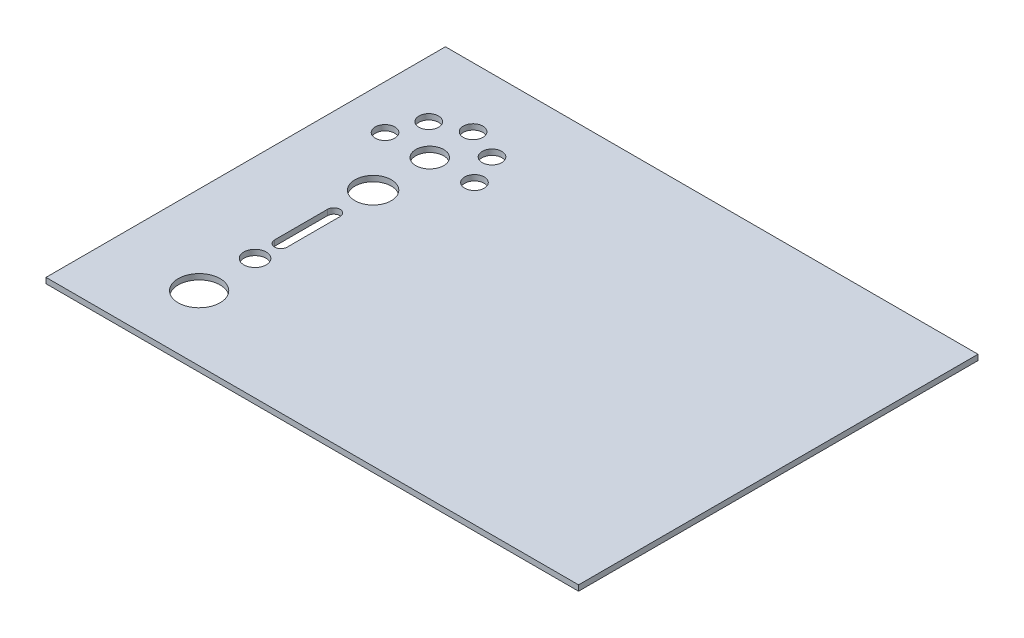
from build123d import *

# Parameters (mm, degrees)
SKETCH1_W           = 609.6
SKETCH1_H           = 457.2
BOSS_EXTRUDE1_DEPTH = 6.35
SKETCH2_R           = 23.995498827
SKETCH2_R_2         = 12.797599375
SKETCH2_R_3         = 20.796098984
SKETCH2_R_4         = 15.996999218
SKETCH2_R_5         = 11.197899453
CUT_EXTRUDE1_DEPTH  = 382.052912992


with BuildPart() as part:
    # Sketch1 → Boss-Extrude1 (new body)
    with BuildSketch(Plane(origin=(0, 0, 0), x_dir=(1, 0, 0), z_dir=(0, 1, 0))):
        Rectangle(SKETCH1_W, SKETCH1_H)
    extrude(amount=BOSS_EXTRUDE1_DEPTH)

    # Sketch2 → Cut-Extrude1 (cut, through all)
    with BuildSketch(Plane(origin=(0, 6.35, 0), x_dir=(1, 0, 0), z_dir=(0, 1, 0))):
        with BuildLine():
            Line((-196.763090385, -60.558852712), (-196.763090385, 0))
            ThreePointArc((-196.763090385, 0), (-203.961740033, 7.198649648), (-211.160389681, 0))
            Line((-211.160389681, 0), (-211.160389681, -60.558852712))
            ThreePointArc((-211.160389681, -60.558852712), (-203.961740033, -67.75750236), (-196.763090385, -60.558852712))
        make_face()
        with Locations((-203.961740033, -154.141298139)):
            Circle(SKETCH2_R)
        with Locations((-203.961740033, -90.153301266)):
            Circle(SKETCH2_R_2)
        with Locations((-203.961740033, 45.021342129)):
            Circle(SKETCH2_R_3)
        with Locations((-203.961740033, 109.809188963)):
            Circle(SKETCH2_R_4)
        with Locations((-254.35228757, 109.009339002)):
            Circle(SKETCH2_R_5)
        with Locations((-240.158817236, 144.875107503)):
            Circle(SKETCH2_R_5)
        with Locations((-204.761589994, 160.1997365)):
            Circle(SKETCH2_R_5)
        with Locations((-168.895821493, 146.006266165)):
            Circle(SKETCH2_R_5)
        with Locations((-153.571192495, 110.609038924)):
            Circle(SKETCH2_R_5)
    extrude(amount=-CUT_EXTRUDE1_DEPTH, mode=Mode.SUBTRACT)


solid = part.part
